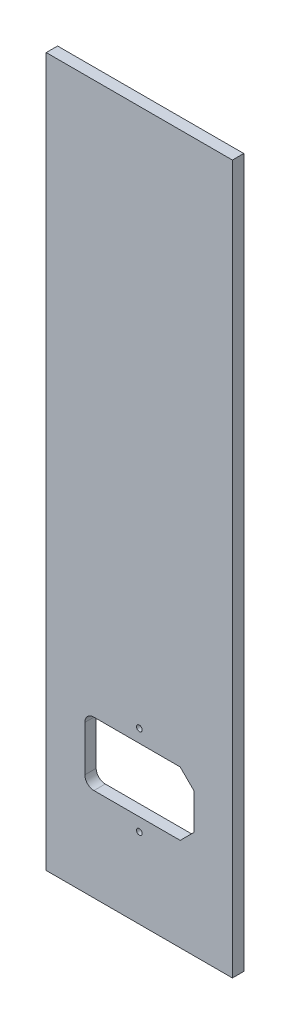
from build123d import *

# Parameters (mm, degrees)
SKETCH1_W           = 82
SKETCH1_H           = 312
BOSS_EXTRUDE1_DEPTH = 5
SKETCH2_R           = 1.25
SKETCH2_W           = 48
SKETCH2_H           = 28
CUT_EXTRUDE1_DEPTH  = 10
CHAMFER1_SIZE       = 6
FILLET1_R           = 4


with BuildPart() as part:
    # Sketch1 → Boss-Extrude1 (new body)
    with BuildSketch(Plane.XY):
        Rectangle(SKETCH1_W, SKETCH1_H)
    extrude(amount=BOSS_EXTRUDE1_DEPTH)

    # Sketch2 → Cut-Extrude1 (cut)
    with BuildSketch(Plane.XY.offset(5)):
        with Locations((0, -81.25)):
            Circle(SKETCH2_R)
        with Locations((0, -120.75)):
            Circle(SKETCH2_R)
        with Locations((0, -101)):
            Rectangle(SKETCH2_W, SKETCH2_H)
    extrude(amount=-CUT_EXTRUDE1_DEPTH, mode=Mode.SUBTRACT)

    # Chamfer1
    chamfer1_edges = [part.edges().sort_by_distance(p)[0] for p in [
        (24, -115, 2.5),
        (24, -87, 2.5),
    ]]
    chamfer(chamfer1_edges, length=CHAMFER1_SIZE)

    # Fillet1
    fillet1_edges = [part.edges().sort_by_distance(p)[0] for p in [
        (-24, -115, 2.5),
        (-24, -87, 2.5),
    ]]
    fillet(fillet1_edges, radius=FILLET1_R)


solid = part.part
